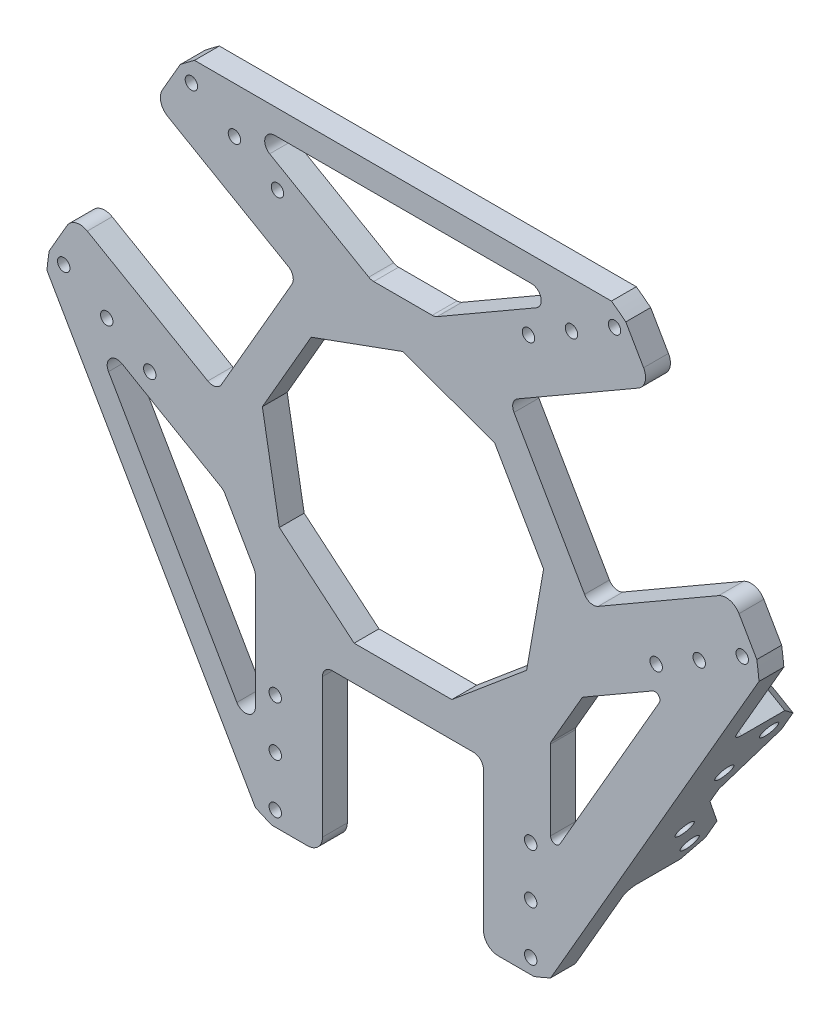
from build123d import *

# Parameters (mm, degrees)
SKETCH_1_R          = 72
SKETCH_1_R_2        = 1.25
EXTRUDE_1_DEPTH     = 5
CUT_EXTRUDE_START   = -10
CUT_EXTRUDE_2_DEPTH = 10
CUT_EXTRUDE_3_DEPTH = 10
EXTRUDE_2_DEPTH     = 5
CUT_EXTRUDE_4_DEPTH = 6
CUT_EXTRUDE_5_DEPTH = 10
FILLET_1_R          = 3
EXTRUDE_3_DEPTH     = 5
SKETCH_13_R         = 1.75
EXTRUDE_4_DEPTH     = 5
FILLET_2_R          = 2
CUT_EXTRUDE_6_DEPTH = 5
FILLET_3_R          = 2


with BuildPart() as part:
    # 草图1 → 凸台-拉伸1 (new body)
    with BuildSketch(Plane.XY):
        Circle(SKETCH_1_R)
        with Locations((25.7, -64)):
            Circle(SKETCH_1_R_2, mode=Mode.SUBTRACT)
        with Locations((25.7, -54)):
            Circle(SKETCH_1_R_2, mode=Mode.SUBTRACT)
        with Locations((25.7, -44)):
            Circle(SKETCH_1_R_2, mode=Mode.SUBTRACT)
        with Locations((-25.7, -44)):
            Circle(SKETCH_1_R_2, mode=Mode.SUBTRACT)
        with Locations((-25.7, -54)):
            Circle(SKETCH_1_R_2, mode=Mode.SUBTRACT)
        with Locations((-25.7, -64)):
            Circle(SKETCH_1_R_2, mode=Mode.SUBTRACT)
        with Locations((-25.255117767, 44.256852877)):
            Circle(SKETCH_1_R_2, mode=Mode.SUBTRACT)
        with Locations((-33.915371804, 49.256852877)):
            Circle(SKETCH_1_R_2, mode=Mode.SUBTRACT)
        with Locations((-42.575625842, 54.256852877)):
            Circle(SKETCH_1_R_2, mode=Mode.SUBTRACT)
        with Locations((-50.955117767, -0.256852877)):
            Circle(SKETCH_1_R_2, mode=Mode.SUBTRACT)
        with Locations((-59.615371804, 4.743147123)):
            Circle(SKETCH_1_R_2, mode=Mode.SUBTRACT)
        with Locations((-68.275625842, 9.743147123)):
            Circle(SKETCH_1_R_2, mode=Mode.SUBTRACT)
        with Locations((50.955117767, -0.256852877)):
            Circle(SKETCH_1_R_2, mode=Mode.SUBTRACT)
        with Locations((59.615371804, 4.743147123)):
            Circle(SKETCH_1_R_2, mode=Mode.SUBTRACT)
        with Locations((68.275625842, 9.743147123)):
            Circle(SKETCH_1_R_2, mode=Mode.SUBTRACT)
        with Locations((25.255117767, 44.256852877)):
            Circle(SKETCH_1_R_2, mode=Mode.SUBTRACT)
        with Locations((33.915371804, 49.256852877)):
            Circle(SKETCH_1_R_2, mode=Mode.SUBTRACT)
        with Locations((42.575625842, 54.256852877)):
            Circle(SKETCH_1_R_2, mode=Mode.SUBTRACT)
    extrude(amount=EXTRUDE_1_DEPTH)

    # 草图3 → 切除-拉伸2 (cut)
    with BuildSketch(Plane.XY.offset(5).offset(CUT_EXTRUDE_START)):
        with BuildLine():
            Line((16.2, -36), (16.2, -70.153830972))
            ThreePointArc((16.2, -70.153830972), (0, -72), (-16.2, -70.153830972))
            Line((-16.2, -70.153830972), (-16.2, -36))
            ThreePointArc((-16.2, -36), (-15.614213562, -34.585786438), (-14.2, -34))
            Line((-14.2, -34), (14.2, -34))
            ThreePointArc((14.2, -34), (15.614213562, -34.585786438), (16.2, -36))
        make_face()
        with BuildLine():
            Line((-23.076914536, 32.029611541), (-52.654999794, 49.106527027))
            ThreePointArc((-52.654999794, 49.106527027), (-62.353829072, 36), (-68.854999794, 21.047303945))
            Line((-68.854999794, 21.047303945), (-39.276914536, 3.970388459))
            ThreePointArc((-39.276914536, 3.970388459), (-37.759276446, 3.770587614), (-36.544863729, 4.702439266))
            Line((-36.544863729, 4.702439266), (-22.344863729, 29.297560734))
            ThreePointArc((-22.344863729, 29.297560734), (-22.145062884, 30.815198824), (-23.076914536, 32.029611541))
        make_face()
        with BuildLine():
            Line((39.276914536, 3.970388459), (68.854999794, 21.047303945))
            ThreePointArc((68.854999794, 21.047303945), (62.353829072, 36), (52.654999794, 49.106527027))
            Line((52.654999794, 49.106527027), (23.076914536, 32.029611541))
            ThreePointArc((23.076914536, 32.029611541), (22.145062884, 30.815198824), (22.344863729, 29.297560734))
            Line((22.344863729, 29.297560734), (36.544863729, 4.702439266))
            ThreePointArc((36.544863729, 4.702439266), (37.759276446, 3.770587614), (39.276914536, 3.970388459))
        make_face()
    extrude(amount=CUT_EXTRUDE_2_DEPTH, mode=Mode.SUBTRACT)

    # 草图5 → 切除-拉伸3 (cut)
    with BuildSketch(Plane.XY.offset(5).offset(CUT_EXTRUDE_START)):
        with BuildLine():
            Line((-41.951694517, 58.515428112), (-6.417930688, 38))
            Line((-6.417930688, 38), (6.417930688, 38))
            Line((6.417930688, 38), (41.951694517, 58.515428112))
            ThreePointArc((41.951694517, 58.515428112), (0, 72), (-41.951694517, 58.515428112))
        make_face()
        with BuildLine():
            Line((71.651694517, 7.073519127), (36.117930688, -13.441908985))
            Line((36.117930688, -13.441908985), (29.7, -24.558091015))
            Line((29.7, -24.558091015), (29.7, -65.58894724))
            ThreePointArc((29.7, -65.58894724), (62.353829072, -36), (71.651694517, 7.073519127))
        make_face()
        with BuildLine():
            Line((-29.7, -65.58894724), (-29.7, -24.558091015))
            Line((-29.7, -24.558091015), (-36.117930688, -13.441908985))
            Line((-36.117930688, -13.441908985), (-71.651694517, 7.073519127))
            ThreePointArc((-71.651694517, 7.073519127), (-62.353829072, -36), (-29.7, -65.58894724))
        make_face()
    extrude(amount=CUT_EXTRUDE_3_DEPTH, mode=Mode.SUBTRACT)

    # 草图6 → 凸台-拉伸2 (add)
    with BuildSketch(Plane.XY.offset(5)):
        Polygon((-71.651694517, 7.073519127), (-29.7, -65.58894724), (-29.7, -55.58894724), (-62.991440479, 2.073519127), align=None)
        Polygon((33.291440479, 53.515428112), (41.951694517, 58.515428112), (-41.951694517, 58.515428112), (-33.291440479, 53.515428112), align=None)
        Polygon((29.7, -55.58894724), (29.7, -65.58894724), (71.651694517, 7.073519127), (62.991440479, 2.073519127), align=None)
    extrude(amount=-EXTRUDE_2_DEPTH)

    # 草图7 → 切除-拉伸4 (cut)
    with BuildSketch(Plane.XY.offset(5)):
        Polygon((-24.883334598, -14.366399928), (-9.827196325, -27), (9.827196325, -27), (24.883334598, -14.366399928), (28.296284065, 4.989398334), (18.46908774, 22.010601666), (0, 28.732799857), (-18.46908774, 22.010601666), (-28.296284065, 4.989398334), align=None)
    extrude(amount=-CUT_EXTRUDE_4_DEPTH, mode=Mode.SUBTRACT)

    # 草图10 → 切除-拉伸5 (cut)
    with BuildSketch(Plane.XY.offset(5).offset(CUT_EXTRUDE_START)):
        with BuildLine():
            Line((-44.842275727, 56.330900114), (-49.923702054, 47.529611541))
            Line((-49.923702054, 47.529611541), (-52.654999794, 49.106527027))
            ThreePointArc((-52.654999794, 49.106527027), (-48.882282835, 52.863242663), (-44.842275727, 56.330900114))
        make_face()
        with BuildLine():
            Line((-68.854999794, 21.047303945), (-66.123702054, 19.470388459))
            Line((-66.123702054, 19.470388459), (-71.20512838, 10.669099886))
            ThreePointArc((-71.20512838, 10.669099886), (-70.22205249, 15.901677398), (-68.854999794, 21.047303945))
        make_face()
        with BuildLine():
            Line((52.654999794, 49.106527027), (49.923702054, 47.529611541))
            Line((49.923702054, 47.529611541), (44.842275727, 56.330900114))
            ThreePointArc((44.842275727, 56.330900114), (48.882282835, 52.863242663), (52.654999794, 49.106527027))
        make_face()
        with BuildLine():
            Line((66.123702054, 19.470388459), (68.854999794, 21.047303945))
            ThreePointArc((68.854999794, 21.047303945), (70.22205249, 15.901677398), (71.20512838, 10.669099886))
            Line((71.20512838, 10.669099886), (66.123702054, 19.470388459))
        make_face()
        with BuildLine():
            Line((16.2, -70.153830972), (16.2, -67))
            Line((16.2, -67), (26.362852653, -67))
            ThreePointArc((26.362852653, -67), (21.339769655, -68.764920061), (16.2, -70.153830972))
        make_face()
        with BuildLine():
            Line((-16.2, -67), (-16.2, -70.153830972))
            ThreePointArc((-16.2, -70.153830972), (-21.339769655, -68.764920061), (-26.362852653, -67))
            Line((-26.362852653, -67), (-16.2, -67))
        make_face()
    extrude(amount=CUT_EXTRUDE_5_DEPTH, mode=Mode.SUBTRACT)

    # 圆角1
    fillet_1_edges = [part.edges().sort_by_distance(p)[0] for p in [
        (16.2, -67, 2.5),
        (-16.2, -67, 2.5),
        (49.923702054, 47.529611541, 2.5),
        (66.123702054, 19.470388459, 2.5),
        (-66.123702054, 19.470388459, 2.5),
        (-49.923702054, 47.529611541, 2.5),
    ]]
    fillet(fillet_1_edges, radius=FILLET_1_R)

    # 草图12 → 凸台-拉伸3 (add)
    with BuildSketch(Plane(origin=(0, 0, 0), x_dir=(-1, 0, 0), z_dir=(0, 0, -1))):
        Polygon((-29.7, -24.558091015), (-29.7, -55.58894724), (-62.991440479, 2.073519127), (-36.117930688, -13.441908985), align=None)
    extrude(amount=-EXTRUDE_3_DEPTH)

    # 草图13 → 凸台-拉伸4 (add)
    with BuildSketch(Plane(origin=(50.675847258, -29.257714056, 0), x_dir=(0, 0, -1), z_dir=(0.8660254037844392, -0.49999999999999906, 0))):
        Polygon((0, 21), (10.656854249, 21), (14, 17.656854249), (14, 12.966018868), (7, 1.766018868), (7, -1.766018868), (14, -12.966018868), (14, -17.656854249), (10.656854249, -21), (0, -21), align=None)
        with Locations((5, 8)):
            Circle(SKETCH_13_R, mode=Mode.SUBTRACT)
        with Locations((10, 16)):
            Circle(SKETCH_13_R, mode=Mode.SUBTRACT)
        with Locations((5, -8)):
            Circle(SKETCH_13_R, mode=Mode.SUBTRACT)
        with Locations((10, -16)):
            Circle(SKETCH_13_R, mode=Mode.SUBTRACT)
    extrude(amount=-EXTRUDE_4_DEPTH)

    # 圆角2
    fillet_2_edges = [part.edges().sort_by_distance(p)[0] for p in [
        (59.010783749, -9.821180577, 0),
        (46.34572024, -26.757714056, 0),
        (38.010783749, -46.194247536, 0),
    ]]
    fillet(fillet_2_edges, radius=FILLET_2_R)

    # 草图14 → 切除-拉伸6 (cut)
    with BuildSketch(Plane(origin=(0, 0, 0), x_dir=(-1, 0, 0), z_dir=(0, 0, -1))):
        with BuildLine():
            Line((-29.7, -24.826040208), (-29.7, -40.826040208))
            ThreePointArc((-29.7, -40.826040208), (-30.441180955, -41.791966034), (-31.566025404, -41.326040208))
            Line((-31.566025404, -41.326040208), (-51.57241336, -6.673959792))
            ThreePointArc((-51.57241336, -6.673959792), (-51.413494737, -5.466853011), (-50.206387956, -5.307934389))
            Line((-50.206387956, -5.307934389), (-36.349981495, -13.307934389))
            ThreePointArc((-36.349981495, -13.307934389), (-36.142874714, -13.466853011), (-35.983956091, -13.673959792))
            Line((-35.983956091, -13.673959792), (-29.833974596, -24.326040208))
            ThreePointArc((-29.833974596, -24.326040208), (-29.734074174, -24.567221163), (-29.7, -24.826040208))
        make_face()
    extrude(amount=-CUT_EXTRUDE_6_DEPTH, mode=Mode.SUBTRACT)

    # 圆角3
    fillet_3_edges = [part.edges().sort_by_distance(p)[0] for p in [
        (-29.7, -55.58894724, 2.5),
        (-29.7, -24.558091015, 2.5),
        (-36.117930688, -13.441908985, 2.5),
        (-62.991440479, 2.073519127, 2.5),
        (-33.291440479, 53.515428112, 2.5),
        (-6.417930688, 38, 2.5),
        (6.417930688, 38, 2.5),
        (33.291440479, 53.515428112, 2.5),
    ]]
    fillet(fillet_3_edges, radius=FILLET_3_R)


solid = part.part
